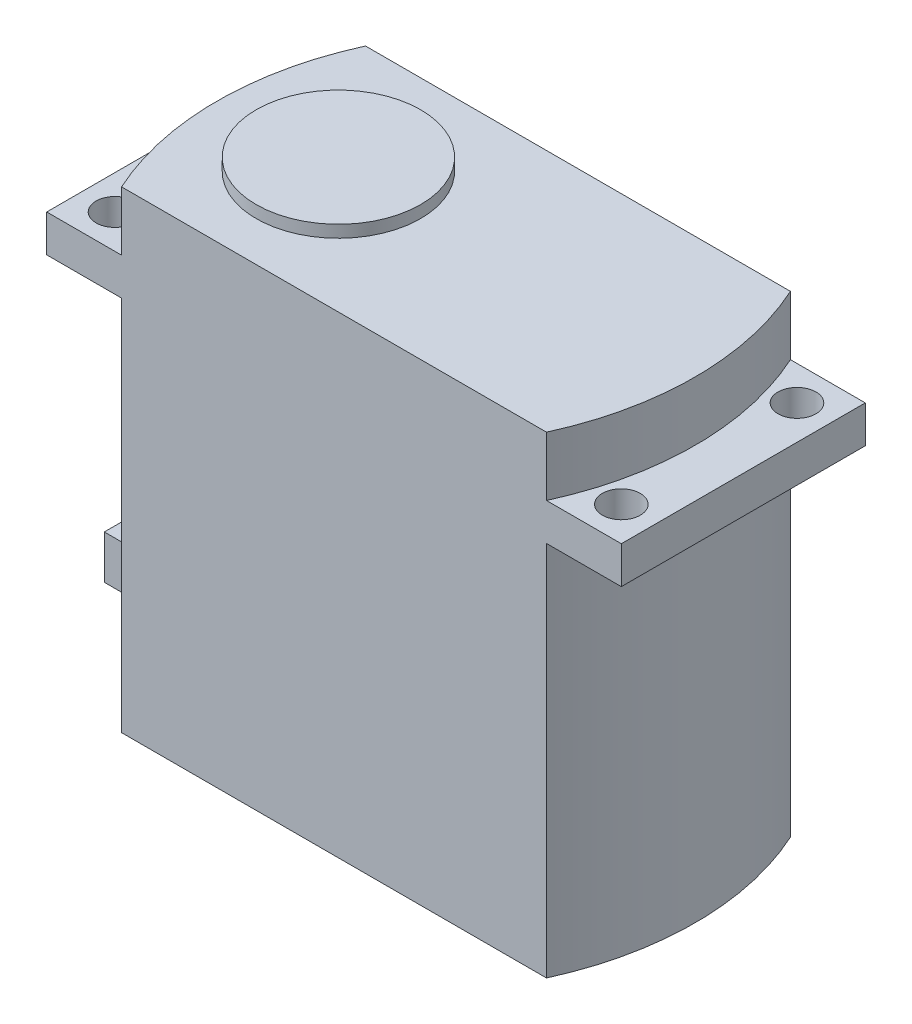
from build123d import *

# Parameters (mm, degrees)
SKETCH1_W           = 63
SKETCH1_H           = 62.3
BOSS_EXTRUDE1_DEPTH = 32.15
SKETCH4_R           = 10.835
BOSS_EXTRUDE3_DEPTH = 1.6
CUT_EXTRUDE1_DEPTH  = 95.254509176
BOSS_EXTRUDE4_START = -6.365
SKETCH3_W           = 32.15
SKETCH3_H           = 4.9
BOSS_EXTRUDE4_DEPTH = 16.365
SKETCH6_R           = 2.5
CUT_EXTRUDE2_DEPTH  = 90.29094299
MIRROR2_DEPTH       = 49.6
MIRROR2_START       = 54.5
MIRROR2_2_DEPTH     = 7.8
MIRROR2_START_2     = 49.6
MIRROR2_3_DEPTH     = 4.9
MIRROR2_4_DEPTH     = 4.9
SKETCH5_W           = 9.7
SKETCH5_H           = 5.75
BOSS_EXTRUDE5_DEPTH = 10


# Read off the part's stored shape, not the designer's step: Mirror2
with BuildPart() as part:
    # Sketch1 → Boss-Extrude1 (new body)
    with BuildSketch(Plane.XY):
        with Locations((31.5, 31.15)):
            Rectangle(SKETCH1_W, SKETCH1_H)
    extrude(amount=BOSS_EXTRUDE1_DEPTH)

    # Sketch4 → Boss-Extrude3 (add)
    with BuildSketch(Plane(origin=(0, 62.3, 0), x_dir=(1, 0, 0), z_dir=(0, 1, 0))):
        with Locations(Location((16, -16.075, 0), (0, 0, 90))):
            Circle(SKETCH4_R)
    extrude(amount=BOSS_EXTRUDE3_DEPTH)

    # Sketch7 → Cut-Extrude1 (cut, through all)
    with BuildSketch(Plane(origin=(0, 62.3, 0), x_dir=(1, 0, 0), z_dir=(0, 1, 0))):
        with BuildLine():
            Line((3.5, 0), (0, 0))
            Line((0, 0), (0, -16.075))
            ThreePointArc((0, -16.075), (0.885131329, -7.849192669), (3.5, 0))
        make_face()
    cut_extrude1 = extrude(amount=-CUT_EXTRUDE1_DEPTH, mode=Mode.SUBTRACT)

    # Mirror1: Cut-Extrude1 across plane
    add(cut_extrude1.mirror(Plane.XY.offset(16.075)), mode=Mode.SUBTRACT)

    # Sketch3 → Boss-Extrude4 (add)
    with BuildSketch(Plane(origin=(0, 0, 0), x_dir=(0, 0, -1), z_dir=(1, 0, 0)).offset(BOSS_EXTRUDE4_START)):
        with Locations((-16.075, 52.05)):
            Rectangle(SKETCH3_W, SKETCH3_H)
    extrude(amount=BOSS_EXTRUDE4_DEPTH)

    # Sketch6 → Cut-Extrude2 (cut, through all)
    with BuildSketch(Plane(origin=(0, 54.5, 0), x_dir=(1, 0, 0), z_dir=(0, 1, 0))):
        with Locations(Location((-1.865, -4.5, 0), (0, 0, 270))):
            Circle(SKETCH6_R)
        with Locations(Location((-1.865, -27.65, 0), (0, 0, 270))):
            Circle(SKETCH6_R)
    extrude(amount=-CUT_EXTRUDE2_DEPTH, mode=Mode.SUBTRACT)

    # Mirror2 outline → Mirror2 (cut)
    with BuildSketch(Plane(origin=(0, 0, 0), x_dir=(1, 0, 0), z_dir=(0, 1, 0))):
        with BuildLine():
            ThreePointArc((63, -16.075), (62.114868671, -24.300807331), (59.5, -32.15))
            Line((59.5, -32.15), (63, -32.15))
            Line((63, -32.15), (63, -16.075))
        make_face()
        with BuildLine():
            ThreePointArc((59.5, 0), (62.114868671, -7.849192669), (63, -16.075))
            Line((63, -16.075), (63, 0))
            Line((63, 0), (59.5, 0))
        make_face()
    extrude(amount=MIRROR2_DEPTH, mode=Mode.SUBTRACT)

    # Mirror2 2 outline → Mirror2 2 (cut)
    with BuildSketch(Plane(origin=(0, 0, 0), x_dir=(1, 0, 0), z_dir=(0, 1, 0)).offset(MIRROR2_START)):
        with BuildLine():
            ThreePointArc((63, -16.075), (62.114868671, -24.300807331), (59.5, -32.15))
            Line((59.5, -32.15), (63, -32.15))
            Line((63, -32.15), (63, -16.075))
        make_face()
        with BuildLine():
            ThreePointArc((59.5, 0), (62.114868671, -7.849192669), (63, -16.075))
            Line((63, -16.075), (63, 0))
            Line((63, 0), (59.5, 0))
        make_face()
    extrude(amount=MIRROR2_2_DEPTH, mode=Mode.SUBTRACT)

    # Mirror2 3 outline → Mirror2 3 (cut)
    with BuildSketch(Plane(origin=(0, 0, 0), x_dir=(1, 0, 0), z_dir=(0, 1, 0)).offset(MIRROR2_START_2)):
        with BuildLine():
            ThreePointArc((63, -2.835135141), (62.365, -4.5), (63, -6.164864859))
            Line((63, -6.164864859), (63, -2.835135141))
        make_face()
        with BuildLine():
            Line((63, -29.314864859), (63, -25.985135141))
            ThreePointArc((63, -25.985135141), (62.365, -27.65), (63, -29.314864859))
        make_face()
    extrude(amount=MIRROR2_3_DEPTH, mode=Mode.SUBTRACT)

    # Mirror2 4 outline → Mirror2 4 (add)
    with BuildSketch(Plane(origin=(0, 0, 0), x_dir=(1, 0, 0), z_dir=(0, 1, 0)).offset(MIRROR2_START_2)):
        with BuildLine():
            Line((63, -6.164864859), (63, -25.985135141))
            ThreePointArc((63, -25.985135141), (67.365, -27.65), (63, -29.314864859))
            Line((63, -29.314864859), (63, -32.15))
            Line((63, -32.15), (69.365, -32.15))
            Line((69.365, -32.15), (69.365, 0))
            Line((69.365, 0), (63, 0))
            Line((63, 0), (63, -2.835135141))
            ThreePointArc((63, -2.835135141), (67.365, -4.5), (63, -6.164864859))
        make_face()
    extrude(amount=MIRROR2_4_DEPTH)


with BuildPart() as body_2:
    # Sketch5 → Boss-Extrude5 (new body)
    with BuildSketch(Plane(origin=(0, 0, 0), x_dir=(0, 0, -1), z_dir=(1, 0, 0))):
        with Locations((-16.075, 7.675)):
            Rectangle(SKETCH5_W, SKETCH5_H)
    extrude(amount=-BOSS_EXTRUDE5_DEPTH)


solid = Compound([part.part, body_2.part])
